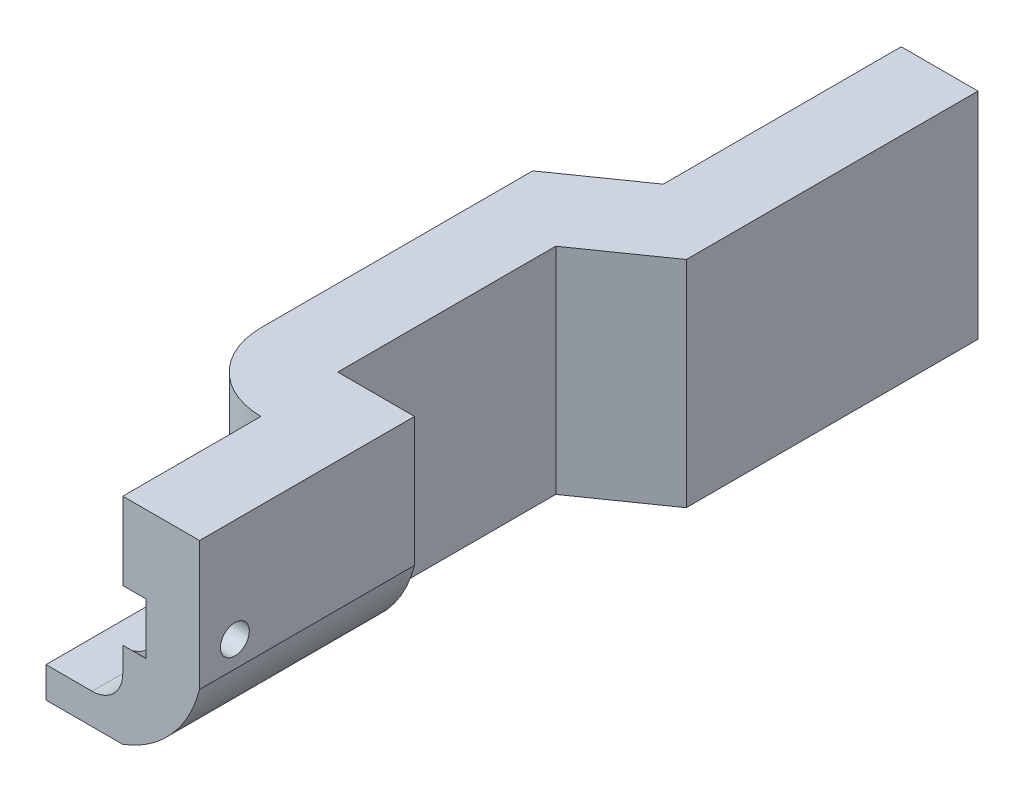
from build123d import *

# Parameters (mm, degrees)
SALIENTE_EXTRUIR1_DEPTH      = 14
SALIENTE_EXTRUIR3_DEPTH      = 9
SALIENTE_EXTRUIR3_DEPTH_BACK = 5
CROQUIS5_R                   = 2.85
CORTAR_EXTRUIR3_DEPTH        = 6.5
CORTAR_EXTRUIR4_DEPTH        = 21
CROQUIS7_R                   = 1
CORTAR_EXTRUIR5_DEPTH        = 5
CROQUIS8_R                   = 0.94
CORTAR_EXTRUIR6_DEPTH        = 45.465042449
REDONDEO2_R                  = 5
REDONDEO3_R                  = 2


with BuildPart() as part:
    # Croquis1 → Saliente-Extruir1 (new body)
    with BuildSketch(Plane(origin=(0, 0, 0), x_dir=(1, 0, 0), z_dir=(0, 1, 0))):
        Polygon((0, 0), (5, 0), (5, 19.2), (10, 22.7), (10, 41.7), (5, 41.7), (5, 26.2), (0, 22.7), align=None)
    extrude(amount=SALIENTE_EXTRUIR1_DEPTH)

    # Croquis2 → Saliente-Extruir3 (add, two sides: drawn at the far end of the back side and taken through both)
    with BuildSketch(Plane.XY.offset(-SALIENTE_EXTRUIR3_DEPTH_BACK)):
        Polygon((0, 0), (0, 2), (5, 2), (5, 14), (10, 14), (10, 0), align=None)
    extrude(amount=SALIENTE_EXTRUIR3_DEPTH + SALIENTE_EXTRUIR3_DEPTH_BACK)

    # Croquis5 → Cortar-Extruir3 (cut)
    with BuildSketch(Plane.ZY):
        with Locations((6.7, 7.28)):
            Circle(CROQUIS5_R)
    extrude(amount=-CORTAR_EXTRUIR3_DEPTH, mode=Mode.SUBTRACT)

    # Croquis6 → Cortar-Extruir4 (cut)
    with BuildSketch(Plane.XY.offset(9)):
        with BuildLine():
            Line((5, 0), (10, 0))
            Line((10, 0), (10, 5.596996732))
            ThreePointArc((10, 5.596996732), (8.187050213, 2.184731514), (5, 0))
        make_face()
    extrude(amount=-CORTAR_EXTRUIR4_DEPTH, mode=Mode.SUBTRACT)

    # Croquis7 → Cortar-Extruir5 (cut)
    with BuildSketch(Plane.XZ):
        with Locations(Location((7.5, -37, 0), (0, 0, 270))):
            Circle(CROQUIS7_R)
        with Locations(Location((2.5, -5.1, 0), (0, 0, 270))):
            Circle(CROQUIS7_R)
    extrude(amount=-CORTAR_EXTRUIR5_DEPTH, mode=Mode.SUBTRACT)

    # Croquis8 → Cortar-Extruir6 (cut, through all)
    with BuildSketch(Plane.ZY.offset(-6.5)):
        with Locations((6.7, 7.28)):
            Circle(CROQUIS8_R)
    extrude(amount=-CORTAR_EXTRUIR6_DEPTH, mode=Mode.SUBTRACT)

    # Redondeo2
    redondeo2_edges = [part.edges().sort_by_distance(p)[0] for p in [
        (0, 8, 0),
    ]]
    fillet(redondeo2_edges, radius=REDONDEO2_R - 0.0001)  # a hair under: the kernel refuses the full size

    # Redondeo3
    redondeo3_edges = [part.edges().sort_by_distance(p)[0] for p in [
        (5, 2, 4.5),
    ]]
    fillet(redondeo3_edges, radius=REDONDEO3_R)


solid = part.part
